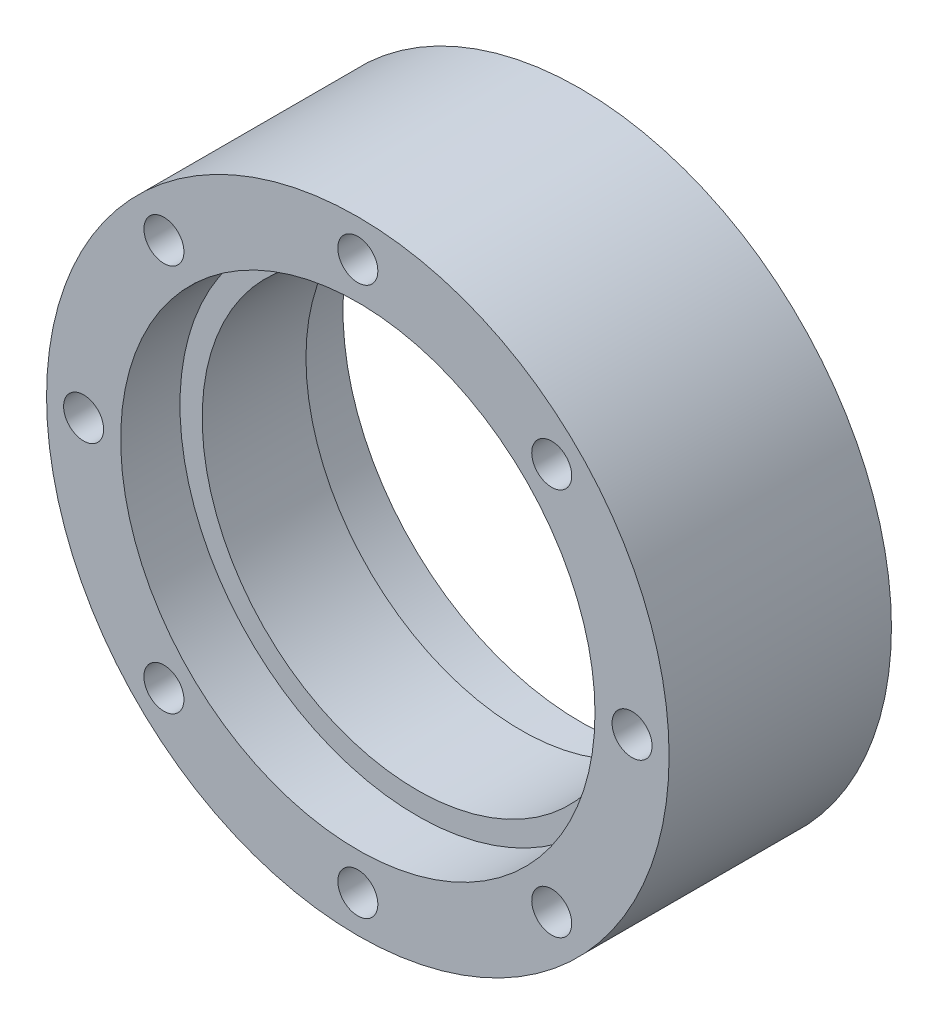
from build123d import *

# Parameters (mm, degrees)
MAINBODY_DEPTH               = 7.5
MAINBODY_DEPTH_BACK          = 7.5
SKETCH1_R                    = 21
SKETCH1_R_2                  = 14.5
SKETCH2_R                    = 16
CUT_EXTRUDE1_DEPTH           = 4
SKETCH3_R                    = 1.35
CUT_EXTRUDE2_DEPTH           = 31.630866785
CUT_EXTRUDE4_START           = -2.5
SKETCH4_R                    = 2.25
CUT_EXTRUDE4_DEPTH           = 36.771609519
CHAMFER1_SIZE                = 0.1
CIRPATTERN1_COUNT            = 8
CHAMFER1_OF_CIRPATTERN1_SIZE = 0.1


with BuildPart() as part:
    # Sketch1 → MainBody (new, two sides: drawn at the far end of the back side and taken through both)
    with BuildSketch(Plane.XY.offset(-MAINBODY_DEPTH_BACK)):
        Circle(SKETCH1_R)
        Circle(SKETCH1_R_2, mode=Mode.SUBTRACT)
    extrude(amount=MAINBODY_DEPTH + MAINBODY_DEPTH_BACK)

    # Sketch2 → Cut-Extrude1 (cut)
    with BuildSketch(Plane.XY.offset(7.5)):
        Circle(SKETCH2_R)
    cut_extrude1 = extrude(amount=-CUT_EXTRUDE1_DEPTH, mode=Mode.SUBTRACT)

    # Mirror1: Cut-Extrude1 across plane
    add(cut_extrude1.mirror(Plane.XY), mode=Mode.SUBTRACT)

    # Sketch3 → Cut-Extrude2 (cut, symmetric)
    with BuildSketch(Plane.XY):
        with Locations((0, 18.5)):
            Circle(SKETCH3_R)
    cut_extrude2 = extrude(amount=CUT_EXTRUDE2_DEPTH, both=True, mode=Mode.SUBTRACT)

    # Sketch4 → Cut-Extrude4 (cut)
    with BuildSketch(Plane(origin=(0, 0, -7.5), x_dir=(-1, 0, 0), z_dir=(0, 0, -1)).offset(CUT_EXTRUDE4_START)):
        with Locations((0, 18.5)):
            Circle(SKETCH4_R)
    cut_extrude4 = extrude(amount=CUT_EXTRUDE4_DEPTH, mode=Mode.SUBTRACT)

    # Chamfer1
    chamfer1_edges = [part.edges().sort_by_distance(p)[0] for p in [
        (-1.35, 18.5, -5),
    ]]
    chamfer(chamfer1_edges, length=CHAMFER1_SIZE)

    # CirPattern1: Cut-Extrude2, Cut-Extrude4 ×8 about axis
    cirpattern1_axis = Axis((0, 0, 8.25), (0, 0, -1))
    add([cut_extrude2.rotate(cirpattern1_axis, i * 360 / CIRPATTERN1_COUNT) for i in range(1, CIRPATTERN1_COUNT)], mode=Mode.SUBTRACT)
    add([cut_extrude4.rotate(cirpattern1_axis, i * 360 / CIRPATTERN1_COUNT) for i in range(1, CIRPATTERN1_COUNT)], mode=Mode.SUBTRACT)

    # Chamfer1 of CirPattern1
    chamfer1_of_cirpattern1_edges = [part.edges().sort_by_distance(p)[0] for p in [
        (12.126881297, 14.036069607, -5),
        (18.5, 1.35, -5),
        (14.036069607, -12.126881297, -5),
        (1.35, -18.5, -5),
        (-12.126881297, -14.036069607, -5),
        (-18.5, -1.35, -5),
        (-14.036069607, 12.126881297, -5),
    ]]
    chamfer(chamfer1_of_cirpattern1_edges, length=CHAMFER1_OF_CIRPATTERN1_SIZE)


solid = part.part
